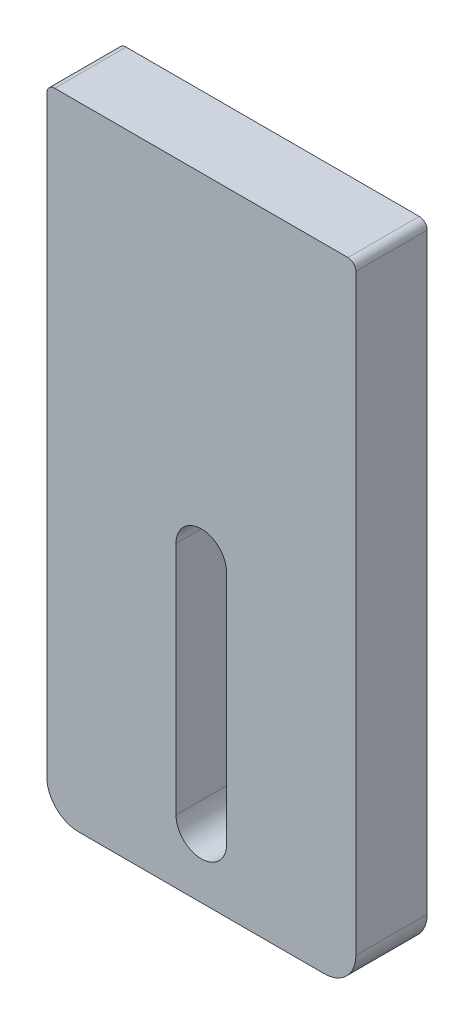
from build123d import *

# Parameters (mm, degrees)
SKETCH1_W           = 19.5
SKETCH1_H           = 39.881833474
BOSS_EXTRUDE1_DEPTH = 5
FILLET1_R           = 2
SKETCH2_W           = 19.5
SKETCH2_H           = 10
CUT_EXTRUDE1_DEPTH  = 0.5
FILLET2_R           = 0.5
CHAMFER1_SIZE       = 0.5


with BuildPart() as part:
    # Sketch1 → Boss-Extrude1 (new body)
    with BuildSketch(Plane.XY):
        with Locations((0, -19.940916737)):
            Rectangle(SKETCH1_W, SKETCH1_H)
        with BuildLine():
            Line((-1.6, -35.881833474), (-1.6, -21.050874329))
            ThreePointArc((-1.6, -21.050874329), (0, -19.450874329), (1.6, -21.050874329))
            Line((1.6, -21.050874329), (1.6, -35.881833474))
            ThreePointArc((1.6, -35.881833474), (0, -37.481833474), (-1.6, -35.881833474))
        make_face(mode=Mode.SUBTRACT)
    extrude(amount=BOSS_EXTRUDE1_DEPTH)

    # Fillet1
    fillet1_edges = [part.edges().sort_by_distance(p)[0] for p in [
        (-9.75, -39.881833474, 2.5),
        (9.75, -39.881833474, 2.5),
    ]]
    fillet(fillet1_edges, radius=FILLET1_R)

    # Sketch2 → Cut-Extrude1 (cut)
    with BuildSketch(Plane.XY):
        with Locations((0, -5)):
            Rectangle(SKETCH2_W, SKETCH2_H)
    extrude(amount=CUT_EXTRUDE1_DEPTH, mode=Mode.SUBTRACT)

    # Fillet2
    fillet2_edges = [part.edges().sort_by_distance(p)[0] for p in [
        (9.75, 0, 2.75),
        (-9.75, 0, 2.75),
    ]]
    fillet(fillet2_edges, radius=FILLET2_R)

    # Chamfer1
    chamfer1_edges = [part.edges().sort_by_distance(p)[0] for p in [
        (-9.75, -23.940916737, 0),
        (-9.164213562, -39.296047036, 0),
        (0, -39.881833474, 0),
        (9.164213562, -39.296047036, 0),
        (9.75, -23.940916737, 0),
    ]]
    chamfer(chamfer1_edges, length=CHAMFER1_SIZE)


solid = part.part
